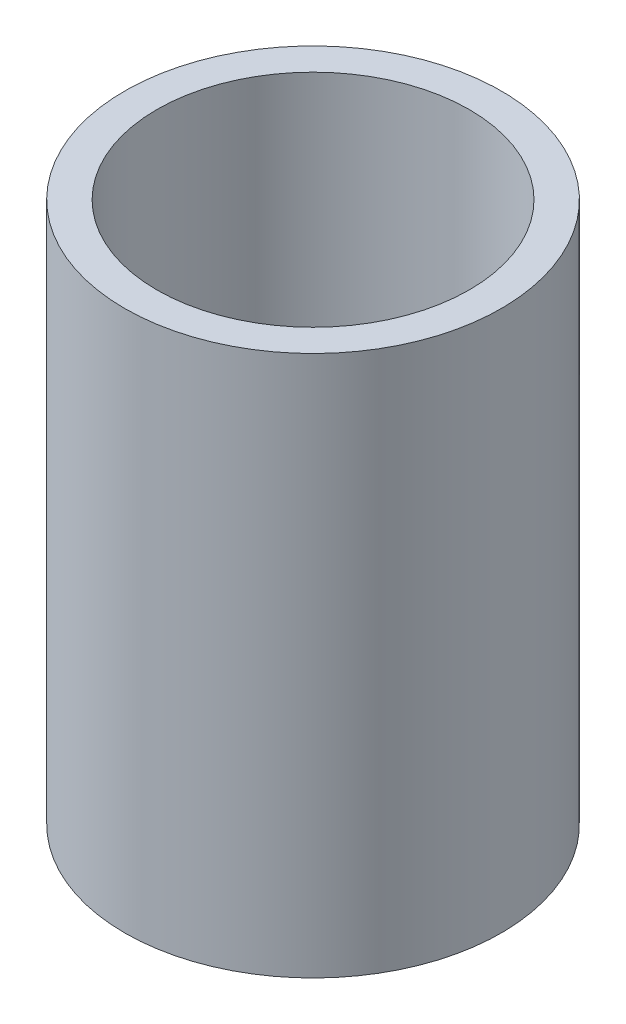
from build123d import *

# Parameters (mm, degrees)
SKETCH1_R           = 25
BOSS_EXTRUDE1_DEPTH = 71.782500558
SKETCH2_R           = 20.737862249
CUT_EXTRUDE1_DEPTH  = 81.017044349


with BuildPart() as part:
    # Sketch1 → Boss-Extrude1 (new body)
    with BuildSketch(Plane(origin=(0, 0, 0), x_dir=(1, 0, 0), z_dir=(0, 1, 0))):
        Circle(SKETCH1_R)
    extrude(amount=BOSS_EXTRUDE1_DEPTH)

    # Sketch2 → Cut-Extrude1 (cut, through all)
    with BuildSketch(Plane(origin=(0, 0, 0), x_dir=(1, 0, 0), z_dir=(0, 1, 0))):
        Circle(SKETCH2_R)
    extrude(amount=CUT_EXTRUDE1_DEPTH, mode=Mode.SUBTRACT)


solid = part.part
